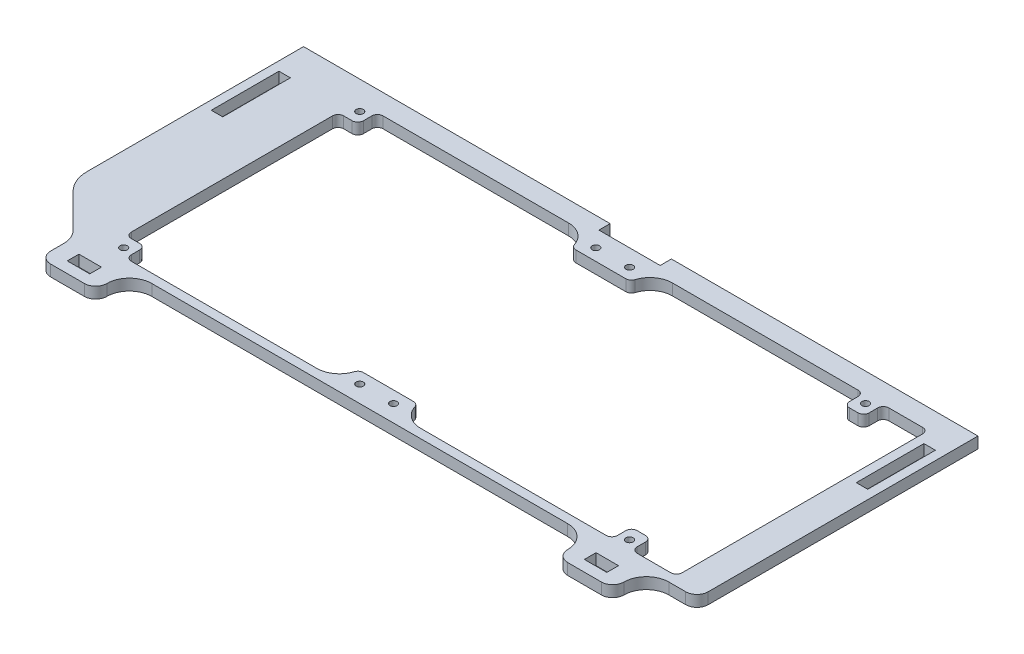
from build123d import *

# Parameters (mm, degrees)
SKETCH1_W           = 255
SKETCH1_H           = 120
SKETCH1_R           = 1.6
BASE_FLANGE1_DEPTH  = 5
CUT_EXTRUDE1_REACH  = 143.001
SKETCH9_W           = 5.1
SKETCH9_H           = 30.1
BOSS_EXTRUDE1_DEPTH = 5
SKETCH10_W          = 25
SKETCH10_H          = 15
SKETCH10_W_2        = 10
SKETCH10_H_2        = 5.2
BOSS_EXTRUDE2_DEPTH = 5
FILLET1_R           = 5
FILLET2_R           = 2.5
FILLET3_R           = 10
CUT_EXTRUDE2_DEPTH  = 168.779617356


# Sheet-metal steps are written as plain solids
with BuildPart() as part:
    # Sketch1 → Base-Flange1 (new body)
    with BuildSketch(Plane(origin=(0, 0, 0), x_dir=(1, 0, 0), z_dir=(0, 1, 0))):
        Rectangle(SKETCH1_W, SKETCH1_H)
        with Locations(Location((-112.5, 52.5, 0), (0, 0, 270))):
            Circle(SKETCH1_R, mode=Mode.SUBTRACT)
        with Locations(Location((-112.5, -52.5, 0), (0, 0, 270))):
            Circle(SKETCH1_R, mode=Mode.SUBTRACT)
        with Locations(Location((-7.5, -52.5, 0), (0, 0, 270))):
            Circle(SKETCH1_R, mode=Mode.SUBTRACT)
        with Locations(Location((-7.5, 52.5, 0), (0, 0, 270))):
            Circle(SKETCH1_R, mode=Mode.SUBTRACT)
        with Locations(Location((7.5, 52.5, 0), (0, 0, 270))):
            Circle(SKETCH1_R, mode=Mode.SUBTRACT)
        with Locations(Location((112.5, 52.5, 0), (0, 0, 270))):
            Circle(SKETCH1_R, mode=Mode.SUBTRACT)
        with Locations(Location((112.5, -52.5, 0), (0, 0, 270))):
            Circle(SKETCH1_R, mode=Mode.SUBTRACT)
        with Locations(Location((7.5, -52.5, 0), (0, 0, 270))):
            Circle(SKETCH1_R, mode=Mode.SUBTRACT)
    extrude(amount=-BASE_FLANGE1_DEPTH)

    # Sketch6 → Cut-Extrude1 (cut, up to next)
    with BuildSketch(Plane(origin=(0, 0, 0), x_dir=(1, 0, 0), z_dir=(0, 1, 0)), mode=Mode.PRIVATE) as cut_extrude1_sk1:
        Polygon((-108.125, 56), (-108.125, 47.25), (-116.875, 47.25), (-116.875, -47.25), (-108.125, -47.25), (-108.125, -56), (-13.625, -56), (-13.625, -47.25), (13.625, -47.25), (13.625, -56), (108.125, -56), (108.125, -47.25), (116.875, -47.25), (116.875, 47.25), (108.125, 47.25), (108.125, 56), (13.625, 56), (13.625, 47.25), (-13.625, 47.25), (-13.625, 56), align=None)
    cut_extrude1_tool1 = extrude(cut_extrude1_sk1.sketch, amount=-CUT_EXTRUDE1_REACH, mode=Mode.PRIVATE) & part.part
    add(cut_extrude1_tool1.solids().sort_by_distance((0, 0, 0))[0], mode=Mode.SUBTRACT)

    # Sketch9 → Boss-Extrude1 (add)
    # profile 1 of 2: a face of its own
    with BuildSketch(Plane(origin=(0, 0, 0), x_dir=(1, 0, 0), z_dir=(0, 1, 0))):
        with BuildLine():
            Line((-150, 60), (-150, -31.286796564))
            ThreePointArc((-150, -31.286796564), (-148.858192988, -37.02704805), (-145.606601718, -41.893398282))
            Line((-145.606601718, -41.893398282), (-127.5, -60))
            Line((-127.5, -60), (-127.5, 60))
            Line((-127.5, 60), (-13.625, 60))
            Line((-13.625, 60), (-13.625, 65))
            Line((-13.625, 65), (-150, 65))
            Line((-150, 65), (-150, 60))
        make_face()
        with Locations((-143.45, 35)):
            Rectangle(SKETCH9_W, SKETCH9_H, mode=Mode.SUBTRACT)
    # profile 2 of 2: a face of its own
    with BuildSketch(Plane(origin=(0, 0, 0), x_dir=(1, 0, 0), z_dir=(0, 1, 0))):
        with BuildLine():
            Line((127.5, 60), (127.5, -60))
            Line((127.5, -60), (145, -60))
            ThreePointArc((145, -60), (148.535533906, -58.535533906), (150, -55))
            Line((150, -55), (150, 60))
            Line((150, 60), (150, 65))
            Line((150, 65), (13.625, 65))
            Line((13.625, 65), (13.625, 60))
            Line((13.625, 60), (127.5, 60))
        make_face()
        with Locations((143.45, 35)):
            Rectangle(SKETCH9_W, SKETCH9_H, mode=Mode.SUBTRACT)
    extrude(amount=-BOSS_EXTRUDE1_DEPTH)

    # Sketch10 → Boss-Extrude2 (add)
    # profile 1 of 2: a face of its own
    with BuildSketch(Plane(origin=(0, 0, 0), x_dir=(1, 0, 0), z_dir=(0, 1, 0))):
        with Locations((115, -67.5)):
            Rectangle(SKETCH10_W, SKETCH10_H)
        with Locations((115, -67.5)):
            Rectangle(SKETCH10_W_2, SKETCH10_H_2, mode=Mode.SUBTRACT)
    # profile 2 of 2: a face of its own
    with BuildSketch(Plane(origin=(0, 0, 0), x_dir=(1, 0, 0), z_dir=(0, 1, 0))):
        with Locations((-115, -67.5)):
            Rectangle(SKETCH10_W, SKETCH10_H)
        with Locations((-115, -67.5)):
            Rectangle(SKETCH10_W_2, SKETCH10_H_2, mode=Mode.SUBTRACT)
    extrude(amount=-BOSS_EXTRUDE2_DEPTH)

    # Fillet1
    fillet1_edges = [part.edges().sort_by_distance(p)[0] for p in [
        (102.5, -2.5, 75),
        (127.5, -2.5, 75),
        (-127.5, -2.5, 75),
        (-102.5, -2.5, 75),
    ]]
    fillet(fillet1_edges, radius=FILLET1_R)

    # Fillet2
    fillet2_edges = [part.edges().sort_by_distance(p)[0] for p in [
        (-108.125, -2.5, -56),
        (-13.625, -2.5, -47.25),
        (13.625, -2.5, -47.25),
        (108.125, -2.5, -56),
        (108.125, -2.5, -47.25),
        (116.875, -2.5, -47.25),
        (116.875, -2.5, 47.25),
        (108.125, -2.5, 47.25),
        (108.125, -2.5, 56),
        (13.625, -2.5, 47.25),
        (-13.625, -2.5, 47.25),
        (-108.125, -2.5, 56),
        (-108.125, -2.5, 47.25),
        (-116.875, -2.5, 47.25),
        (-116.875, -2.5, -47.25),
        (-108.125, -2.5, -47.25),
    ]]
    fillet(fillet2_edges, radius=FILLET2_R)

    # Fillet3
    # the kernel refuses this fillet: 10 mm, written as the material it adds along each edge
    with BuildSketch(Plane(origin=(127.5, 0, 60), x_dir=(0, 0, 1), z_dir=(0, -1, 0))) as fillet3_piece_1:
        with BuildLine():
            CenterArc((FILLET3_R, -FILLET3_R), FILLET3_R, 90, 90)
            Line((0, -FILLET3_R), (0, 0))
            Line((0, 0), (FILLET3_R, 0))
        make_face()
    extrude(amount=5)
    with BuildSketch(Plane(origin=(102.5, 0, 60), x_dir=(0, 0, 1), z_dir=(0, -1, 0)), Plane(origin=(-102.5, 0, 60), x_dir=(1, 0, 0), z_dir=(0, -1, 0))) as fillet3_piece_2:
        with BuildLine():
            CenterArc((FILLET3_R, FILLET3_R), FILLET3_R, 180, 90)
            Line((0, FILLET3_R), (0, 0))
            Line((0, 0), (FILLET3_R, 0))
        make_face()
    extrude(amount=5)
    with BuildSketch(Plane(origin=(-13.625, 0, -56), x_dir=(-1, 0, 0), z_dir=(0, -1, 0))) as fillet3_piece_3:
        with BuildLine():
            CenterArc((9.424240018, -10), FILLET3_R, 90, 72.542396876)
            Line((-0.115151996, -7), (-1.069091198, -6.7))
            ThreePointArc((-1.069091198, -6.7), (-1, -6.25), (-1, 0))
            Line((-1, 0), (0, 1))
            Line((0, 1), (9.424240018, 1))
            Line((9.424240018, 1), (9.424240018, 0))
        make_face()
    extrude(amount=5)
    with BuildSketch(Plane(origin=(13.625, 0, -56), x_dir=(-0.01644805983855046, 0, 0.9998647215136394), z_dir=(0, -1, 0))) as fillet3_piece_4:
        with BuildLine():
            CenterArc((9.843636751, -9.587445719), FILLET3_R, 106.515156216, 72.542396876)
            Line((-0.155010464, -9.422965121), (-1.154875185, -9.406517061))
            Line((-1.154875185, -9.406517061), (-0.999864722, 0.01644806))
            Line((-0.999864722, 0.01644806), (0.01644806, 0.999864722))
            ThreePointArc((0.01644806, 0.999864722), (6.265602569, 0.897064348), (6.71667811, 0.958744572))
            Line((6.71667811, 0.958744572), (7.000947078, 0))
        make_face()
    extrude(amount=5)
    with BuildSketch(Plane(origin=(13.625, 0, 56), x_dir=(-0.01644805983855046, 0, -0.9998647215136394), z_dir=(0, -1, 0))) as fillet3_piece_5:
        with BuildLine():
            CenterArc((9.843636751, 9.587445719), FILLET3_R, 180.942446908, 72.542396876)
            Line((-0.155010464, 9.422965121), (-1.154875185, 9.406517061))
            Line((-1.154875185, 9.406517061), (-0.999864722, -0.01644806))
            Line((-0.999864722, -0.01644806), (0.01644806, -0.999864722))
            ThreePointArc((0.01644806, -0.999864722), (6.265602569, -0.897064348), (6.71667811, -0.958744572))
            Line((6.71667811, -0.958744572), (7.000947078, 0))
        make_face()
    extrude(amount=5)
    with BuildSketch(Plane(origin=(-13.625, 0, 56), x_dir=(-1, 0, 0), z_dir=(0, -1, 0))) as fillet3_piece_6:
        with BuildLine():
            CenterArc((9.424240018, 10), FILLET3_R, 197.457603124, 72.542396876)
            Line((-0.115151996, 7), (-1.069091198, 6.7))
            ThreePointArc((-1.069091198, 6.7), (-1, 6.25), (-1, 0))
            Line((-1, 0), (0, -1))
            Line((0, -1), (9.424240018, -1))
            Line((9.424240018, -1), (9.424240018, 0))
        make_face()
    extrude(amount=5)
    with BuildSketch(Plane(origin=(-127.5, 0, 60), x_dir=(0, 0, 1), z_dir=(0, -1, 0))) as fillet3_piece_7:
        with BuildLine():
            CenterArc((FILLET3_R * 0.414213562373, FILLET3_R), FILLET3_R, 225, 45)
            Line((-FILLET3_R * 0.292893218813, FILLET3_R * 0.292893218813), (0, 0))
            Line((0, 0), (FILLET3_R * 0.414213562373, 0))
        make_face()
    extrude(amount=5)

    # Sketch11 → Cut-Extrude2 (cut, through all)
    with BuildSketch(Plane(origin=(0, 0, 0), x_dir=(1, 0, 0), z_dir=(0, 1, 0))):
        with BuildLine():
            Line((116.875, 49.75), (116.875, 53.5))
            ThreePointArc((116.875, 53.5), (117.607233047, 55.267766953), (119.375, 56))
            Line((119.375, 56), (134.375, 56))
            ThreePointArc((134.375, 56), (136.142766953, 55.267766953), (136.875, 53.5))
            Line((136.875, 53.5), (136.875, -53.5))
            ThreePointArc((136.875, -53.5), (136.142766953, -55.267766953), (134.375, -56))
            Line((134.375, -56), (119.375, -56))
            ThreePointArc((119.375, -56), (117.607233047, -55.267766953), (116.875, -53.5))
            Line((116.875, -53.5), (116.875, -49.75))
            ThreePointArc((116.875, -49.75), (116.142766953, -47.982233047), (114.375, -47.25))
            ThreePointArc((114.375, -47.25), (116.142766953, -46.517766953), (116.875, -44.75))
            Line((116.875, -44.75), (116.875, 44.75))
            ThreePointArc((116.875, 44.75), (116.142766953, 46.517766953), (114.375, 47.25))
            ThreePointArc((114.375, 47.25), (116.142766953, 47.982233047), (116.875, 49.75))
        make_face()
    extrude(amount=-CUT_EXTRUDE2_DEPTH, mode=Mode.SUBTRACT)


solid = part.part
